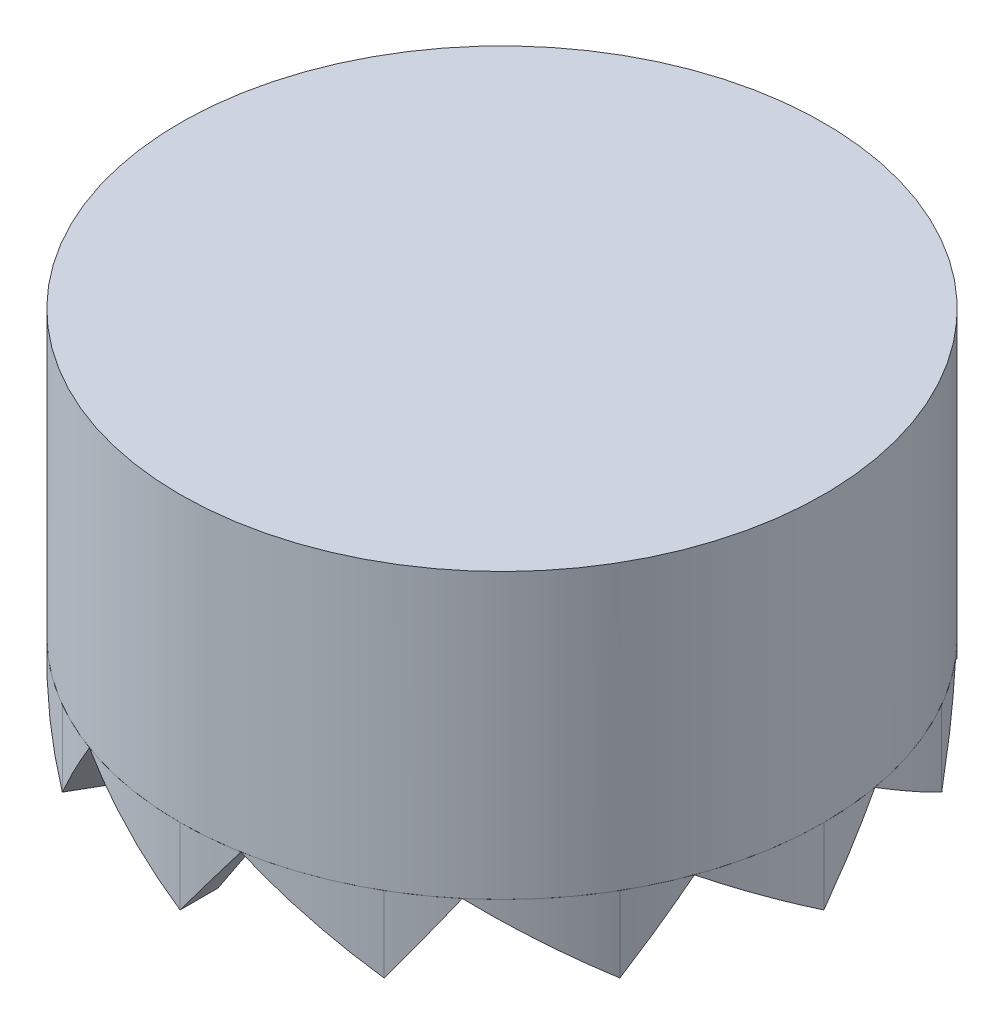
from build123d import *

# Parameters (mm, degrees)
SKETCH_7_R               = 34
SKETCH_7_R_2             = 30
EXTRUDE_3_DEPTH          = 20
EXTRUDE_5_DEPTH          = 8
SWEEP_5_PITCH            = 144
EXTRUDE_6_DEPTH          = 10
SWEEP_7_PITCH            = 288
PATTERN_CIRCULAR_4_COUNT = 12
PATTERN_CIRCULAR_5_COUNT = 12
EXTRUDE_START            = 10
SKETCH_24_R              = 34
EXTRUDE_7_DEPTH          = 10


with BuildPart() as part:
    # 草图7 → 凸台-拉伸3 (new body)
    with BuildSketch(Plane.XZ):
        with Locations(Location((0, 0, 0), (0, 0, 270))):
            Circle(SKETCH_7_R)
        with Locations(Location((0, 0, 0), (0, 0, 270))):
            Circle(SKETCH_7_R_2, mode=Mode.SUBTRACT)
    extrude(amount=EXTRUDE_3_DEPTH)

    # 草图24 → 凸台-拉伸7 (add)
    with BuildSketch(Plane(origin=(0, 0, 0), x_dir=(1, 0, 0), z_dir=(0, 1, 0)).offset(EXTRUDE_START)):
        with Locations(Location((0, 0, 0), (0, 0, 270))):
            Circle(SKETCH_24_R)
    extrude(amount=-EXTRUDE_7_DEPTH)


with BuildPart() as body_2:
    # 草图11 → 凸台-拉伸5 (new body)
    with BuildSketch(Plane.XZ.offset(20)):
        with BuildLine():
            ThreePointArc((0, 34), (-5.904038041, 33.483463602), (-11.628684873, 31.949549107))
            Line((-11.628684873, 31.949549107), (-10.2606043, 28.190778624))
            ThreePointArc((-10.2606043, 28.190778624), (-5.20944533, 29.54423259), (0, 30))
            Line((0, 30), (0, 34))
        make_face()
    extrude(amount=EXTRUDE_5_DEPTH)

    # 切除-扫描5: the profile of 草图13 profile screwed along a left-hand helix of 1 turns, 38 arcs to a turn; built about Z, then put on its axis
    sweep_5_z = Axis((0, 0, 0), (0, 0, 1))
    sweep_5_corners = [(29.9997, 0, 0), (45.797886043, 0, 0), (45.797886043, 0, -49.535844215), (29.9997, 0, -49.535844215)]
    with BuildLine(mode=Mode.PRIVATE) as sweep_5_profile:
        Line(sweep_5_corners[0], sweep_5_corners[1])
        Line(sweep_5_corners[1], sweep_5_corners[2])
        Line(sweep_5_corners[2], sweep_5_corners[3])
        Line(sweep_5_corners[3], sweep_5_corners[0])
    sweep_5_cap = Face(sweep_5_profile.wire())
    sweep_5_turn_angles = [0, -4.736842105, -9.473684211, -14.210526316, -18.947368421, -23.684210526, -28.421052632, -33.157894737, -37.894736842, -42.631578947, -47.368421053, -52.105263158, -56.842105263, -61.578947368, -66.315789474, -71.052631579, -75.789473684, -80.526315789, -85.263157895, -90, -94.736842105, -99.473684211, -104.210526316, -108.947368421, -113.684210526, -118.421052632, -123.157894737, -127.894736842, -132.631578947, -137.368421053, -142.105263158, -146.842105263, -151.578947368, -156.315789474, -161.052631579, -165.789473684, -170.526315789, -175.263157895, -180, -184.736842105, -189.473684211, -194.210526316, -198.947368421, -203.684210526, -208.421052632, -213.157894737, -217.894736842, -222.631578947, -227.368421053, -232.105263158, -236.842105263, -241.578947368, -246.315789474, -251.052631579, -255.789473684, -260.526315789, -265.263157895, -270, -274.736842105, -279.473684211, -284.210526316, -288.947368421, -293.684210526, -298.421052632, -303.157894737, -307.894736842, -312.631578947, -317.368421053, -322.105263158, -326.842105263, -331.578947368, -336.315789474, -341.052631579, -345.789473684, -350.526315789, -355.263157895, -360]
    sweep_5_turn_weights = [1, 0.9965844930066698, 1, 0.9965844930066698, 1, 0.9965844930066698, 1, 0.9965844930066698, 1, 0.9965844930066698, 1, 0.9965844930066698, 1, 0.9965844930066698, 1, 0.9965844930066698, 1, 0.9965844930066698, 1, 0.9965844930066698, 1, 0.9965844930066698, 1, 0.9965844930066698, 1, 0.9965844930066698, 1, 0.9965844930066698, 1, 0.9965844930066698, 1, 0.9965844930066698, 1, 0.9965844930066698, 1, 0.9965844930066698, 1, 0.9965844930066698, 1, 0.9965844930066698, 1, 0.9965844930066698, 1, 0.9965844930066698, 1, 0.9965844930066698, 1, 0.9965844930066698, 1, 0.9965844930066698, 1, 0.9965844930066698, 1, 0.9965844930066698, 1, 0.9965844930066698, 1, 0.9965844930066698, 1, 0.9965844930066698, 1, 0.9965844930066698, 1, 0.9965844930066698, 1, 0.9965844930066698, 1, 0.9965844930066698, 1, 0.9965844930066698, 1, 0.9965844930066698, 1, 0.9965844930066698, 1, 0.9965844930066698, 1]
    sweep_5_turn_rails = [Edge.make_bspline([Vector(p[0], p[1], 0).rotate(sweep_5_z, sweep_5_turn_angles[k]) / sweep_5_turn_weights[k] + Vector(0, 0, p[2] + -SWEEP_5_PITCH * sweep_5_turn_angles[k] / 360) for k in range(77)], [0, 0, 0, 1, 1, 2, 2, 3, 3, 4, 4, 5, 5, 6, 6, 7, 7, 8, 8, 9, 9, 10, 10, 11, 11, 12, 12, 13, 13, 14, 14, 15, 15, 16, 16, 17, 17, 18, 18, 19, 19, 20, 20, 21, 21, 22, 22, 23, 23, 24, 24, 25, 25, 26, 26, 27, 27, 28, 28, 29, 29, 30, 30, 31, 31, 32, 32, 33, 33, 34, 34, 35, 35, 36, 36, 37, 37, 38, 38, 38], 2, sweep_5_turn_weights) for p in sweep_5_corners]
    sweep_5_turn_sides = [Face.make_surface_from_curves(sweep_5_turn_rails[p[0]], sweep_5_turn_rails[p[1]]) for p in [(0, 1), (1, 2), (2, 3), (3, 0)]]
    sweep_5 = Plane(origin=(0, -28, 0), x_dir=(0, 0, 1), z_dir=(0, 1, 0)) * Solid(Shell([*sweep_5_turn_sides, sweep_5_cap, sweep_5_cap.rotate(sweep_5_z, -360).moved(Location((0, 0, -SWEEP_5_PITCH * -360 / 360)))]))
    add(sweep_5, mode=Mode.SUBTRACT)


with BuildPart() as body_3:
    # 草图11<3> → 凸台-拉伸6 (new body)
    with BuildSketch(Plane.XZ.offset(20)):
        with BuildLine():
            ThreePointArc((5.904038041, 33.483463602), (2.963295253, 33.870619735), (0, 34))
            Line((0, 34), (0, 30))
            ThreePointArc((0, 30), (2.614672282, 29.885840943), (5.20944533, 29.54423259))
            Line((5.20944533, 29.54423259), (5.904038041, 33.483463602))
        make_face()
    extrude(amount=EXTRUDE_6_DEPTH)

    # 切除-扫描7: the profile of 草图13<3> profile screwed along a right-hand helix of 1 turns, 48 arcs to a turn; built about Z, then put on its axis
    sweep_7_z = Axis((0, 0, 0), (0, 0, 1))
    sweep_7_corners = [(29.9997, 0, 2), (45.797886043, 0, 2), (45.797886043, 0, -47.535844215), (29.9997, 0, -47.535844215)]
    with BuildLine(mode=Mode.PRIVATE) as sweep_7_profile:
        Line(sweep_7_corners[0], sweep_7_corners[1])
        Line(sweep_7_corners[1], sweep_7_corners[2])
        Line(sweep_7_corners[2], sweep_7_corners[3])
        Line(sweep_7_corners[3], sweep_7_corners[0])
    sweep_7_cap = Face(sweep_7_profile.wire())
    sweep_7_turn_angles = [0, 3.75, 7.5, 11.25, 15, 18.75, 22.5, 26.25, 30, 33.75, 37.5, 41.25, 45, 48.75, 52.5, 56.25, 60, 63.75, 67.5, 71.25, 75, 78.75, 82.5, 86.25, 90, 93.75, 97.5, 101.25, 105, 108.75, 112.5, 116.25, 120, 123.75, 127.5, 131.25, 135, 138.75, 142.5, 146.25, 150, 153.75, 157.5, 161.25, 165, 168.75, 172.5, 176.25, 180, 183.75, 187.5, 191.25, 195, 198.75, 202.5, 206.25, 210, 213.75, 217.5, 221.25, 225, 228.75, 232.5, 236.25, 240, 243.75, 247.5, 251.25, 255, 258.75, 262.5, 266.25, 270, 273.75, 277.5, 281.25, 285, 288.75, 292.5, 296.25, 300, 303.75, 307.5, 311.25, 315, 318.75, 322.5, 326.25, 330, 333.75, 337.5, 341.25, 345, 348.75, 352.5, 356.25, 360]
    sweep_7_turn_weights = [1, 0.9978589232386035, 1, 0.9978589232386035, 1, 0.9978589232386035, 1, 0.9978589232386035, 1, 0.9978589232386035, 1, 0.9978589232386035, 1, 0.9978589232386035, 1, 0.9978589232386035, 1, 0.9978589232386035, 1, 0.9978589232386035, 1, 0.9978589232386035, 1, 0.9978589232386035, 1, 0.9978589232386035, 1, 0.9978589232386035, 1, 0.9978589232386035, 1, 0.9978589232386035, 1, 0.9978589232386035, 1, 0.9978589232386035, 1, 0.9978589232386035, 1, 0.9978589232386035, 1, 0.9978589232386035, 1, 0.9978589232386035, 1, 0.9978589232386035, 1, 0.9978589232386035, 1, 0.9978589232386035, 1, 0.9978589232386035, 1, 0.9978589232386035, 1, 0.9978589232386035, 1, 0.9978589232386035, 1, 0.9978589232386035, 1, 0.9978589232386035, 1, 0.9978589232386035, 1, 0.9978589232386035, 1, 0.9978589232386035, 1, 0.9978589232386035, 1, 0.9978589232386035, 1, 0.9978589232386035, 1, 0.9978589232386035, 1, 0.9978589232386035, 1, 0.9978589232386035, 1, 0.9978589232386035, 1, 0.9978589232386035, 1, 0.9978589232386035, 1, 0.9978589232386035, 1, 0.9978589232386035, 1, 0.9978589232386035, 1, 0.9978589232386035, 1, 0.9978589232386035, 1]
    sweep_7_turn_rails = [Edge.make_bspline([Vector(p[0], p[1], 0).rotate(sweep_7_z, sweep_7_turn_angles[k]) / sweep_7_turn_weights[k] + Vector(0, 0, p[2] + SWEEP_7_PITCH * sweep_7_turn_angles[k] / 360) for k in range(97)], [0, 0, 0, 1, 1, 2, 2, 3, 3, 4, 4, 5, 5, 6, 6, 7, 7, 8, 8, 9, 9, 10, 10, 11, 11, 12, 12, 13, 13, 14, 14, 15, 15, 16, 16, 17, 17, 18, 18, 19, 19, 20, 20, 21, 21, 22, 22, 23, 23, 24, 24, 25, 25, 26, 26, 27, 27, 28, 28, 29, 29, 30, 30, 31, 31, 32, 32, 33, 33, 34, 34, 35, 35, 36, 36, 37, 37, 38, 38, 39, 39, 40, 40, 41, 41, 42, 42, 43, 43, 44, 44, 45, 45, 46, 46, 47, 47, 48, 48, 48], 2, sweep_7_turn_weights) for p in sweep_7_corners]
    sweep_7_turn_sides = [Face.make_surface_from_curves(sweep_7_turn_rails[p[0]], sweep_7_turn_rails[p[1]]) for p in [(0, 1), (1, 2), (2, 3), (3, 0)]]
    sweep_7 = Plane(origin=(0, -30, 0), x_dir=(0, 0, 1), z_dir=(0, 1, 0)) * Solid(Shell([*sweep_7_turn_sides, sweep_7_cap, sweep_7_cap.rotate(sweep_7_z, 360).moved(Location((0, 0, SWEEP_7_PITCH * 360 / 360)))]))
    add(sweep_7, mode=Mode.SUBTRACT)


with BuildPart() as pattern_circular_4_1:
    # 阵列(圆周)4: pattern copy
    add(body_2.part.rotate(Axis((0, -20, 0), (0, 1, 0)), 1 * 360 / PATTERN_CIRCULAR_4_COUNT))


with BuildPart() as pattern_circular_4_2:
    # 阵列(圆周)4: pattern copy
    add(body_2.part.rotate(Axis((0, -20, 0), (0, 1, 0)), 2 * 360 / PATTERN_CIRCULAR_4_COUNT))


with BuildPart() as pattern_circular_4_3:
    # 阵列(圆周)4: pattern copy
    add(body_2.part.rotate(Axis((0, -20, 0), (0, 1, 0)), 3 * 360 / PATTERN_CIRCULAR_4_COUNT))


with BuildPart() as pattern_circular_4_4:
    # 阵列(圆周)4: pattern copy
    add(body_2.part.rotate(Axis((0, -20, 0), (0, 1, 0)), 4 * 360 / PATTERN_CIRCULAR_4_COUNT))


with BuildPart() as pattern_circular_4_5:
    # 阵列(圆周)4: pattern copy
    add(body_2.part.rotate(Axis((0, -20, 0), (0, 1, 0)), 5 * 360 / PATTERN_CIRCULAR_4_COUNT))


with BuildPart() as pattern_circular_4_6:
    # 阵列(圆周)4: pattern copy
    add(body_2.part.rotate(Axis((0, -20, 0), (0, 1, 0)), 6 * 360 / PATTERN_CIRCULAR_4_COUNT))


with BuildPart() as pattern_circular_4_7:
    # 阵列(圆周)4: pattern copy
    add(body_2.part.rotate(Axis((0, -20, 0), (0, 1, 0)), 7 * 360 / PATTERN_CIRCULAR_4_COUNT))


with BuildPart() as pattern_circular_4_8:
    # 阵列(圆周)4: pattern copy
    add(body_2.part.rotate(Axis((0, -20, 0), (0, 1, 0)), 8 * 360 / PATTERN_CIRCULAR_4_COUNT))


with BuildPart() as pattern_circular_4_9:
    # 阵列(圆周)4: pattern copy
    add(body_2.part.rotate(Axis((0, -20, 0), (0, 1, 0)), 9 * 360 / PATTERN_CIRCULAR_4_COUNT))


with BuildPart() as pattern_circular_4_10:
    # 阵列(圆周)4: pattern copy
    add(body_2.part.rotate(Axis((0, -20, 0), (0, 1, 0)), 10 * 360 / PATTERN_CIRCULAR_4_COUNT))


with BuildPart() as pattern_circular_4_11:
    # 阵列(圆周)4: pattern copy
    add(body_2.part.rotate(Axis((0, -20, 0), (0, 1, 0)), 11 * 360 / PATTERN_CIRCULAR_4_COUNT))


with BuildPart() as pattern_circular_5_1:
    # 阵列(圆周)5: pattern copy
    add(body_3.part.rotate(Axis((0, -20, 0), (0, 1, 0)), 1 * 360 / PATTERN_CIRCULAR_5_COUNT))


with BuildPart() as pattern_circular_5_2:
    # 阵列(圆周)5: pattern copy
    add(body_3.part.rotate(Axis((0, -20, 0), (0, 1, 0)), 2 * 360 / PATTERN_CIRCULAR_5_COUNT))


with BuildPart() as pattern_circular_5_3:
    # 阵列(圆周)5: pattern copy
    add(body_3.part.rotate(Axis((0, -20, 0), (0, 1, 0)), 3 * 360 / PATTERN_CIRCULAR_5_COUNT))


with BuildPart() as pattern_circular_5_4:
    # 阵列(圆周)5: pattern copy
    add(body_3.part.rotate(Axis((0, -20, 0), (0, 1, 0)), 4 * 360 / PATTERN_CIRCULAR_5_COUNT))


with BuildPart() as pattern_circular_5_5:
    # 阵列(圆周)5: pattern copy
    add(body_3.part.rotate(Axis((0, -20, 0), (0, 1, 0)), 5 * 360 / PATTERN_CIRCULAR_5_COUNT))


with BuildPart() as pattern_circular_5_6:
    # 阵列(圆周)5: pattern copy
    add(body_3.part.rotate(Axis((0, -20, 0), (0, 1, 0)), 6 * 360 / PATTERN_CIRCULAR_5_COUNT))


with BuildPart() as pattern_circular_5_7:
    # 阵列(圆周)5: pattern copy
    add(body_3.part.rotate(Axis((0, -20, 0), (0, 1, 0)), 7 * 360 / PATTERN_CIRCULAR_5_COUNT))


with BuildPart() as pattern_circular_5_8:
    # 阵列(圆周)5: pattern copy
    add(body_3.part.rotate(Axis((0, -20, 0), (0, 1, 0)), 8 * 360 / PATTERN_CIRCULAR_5_COUNT))


with BuildPart() as pattern_circular_5_9:
    # 阵列(圆周)5: pattern copy
    add(body_3.part.rotate(Axis((0, -20, 0), (0, 1, 0)), 9 * 360 / PATTERN_CIRCULAR_5_COUNT))


with BuildPart() as pattern_circular_5_10:
    # 阵列(圆周)5: pattern copy
    add(body_3.part.rotate(Axis((0, -20, 0), (0, 1, 0)), 10 * 360 / PATTERN_CIRCULAR_5_COUNT))


with BuildPart() as pattern_circular_5_11:
    # 阵列(圆周)5: pattern copy
    add(body_3.part.rotate(Axis((0, -20, 0), (0, 1, 0)), 11 * 360 / PATTERN_CIRCULAR_5_COUNT))


solid = Compound([part.part, body_2.part, body_3.part, pattern_circular_4_1.part, pattern_circular_4_2.part, pattern_circular_4_3.part, pattern_circular_4_4.part, pattern_circular_4_5.part, pattern_circular_4_6.part, pattern_circular_4_7.part, pattern_circular_4_8.part, pattern_circular_4_9.part, pattern_circular_4_10.part, pattern_circular_4_11.part, pattern_circular_5_1.part, pattern_circular_5_2.part, pattern_circular_5_3.part, pattern_circular_5_4.part, pattern_circular_5_5.part, pattern_circular_5_6.part, pattern_circular_5_7.part, pattern_circular_5_8.part, pattern_circular_5_9.part, pattern_circular_5_10.part, pattern_circular_5_11.part])
